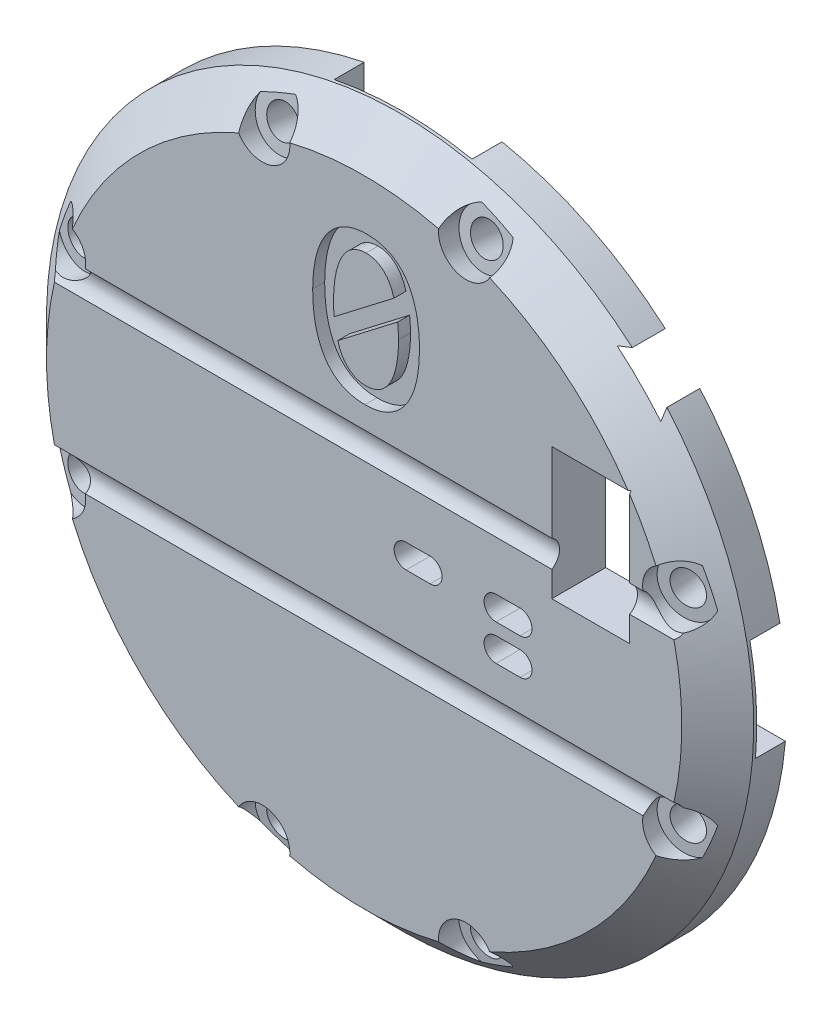
from build123d import *

# Parameters (mm, degrees)
SKETCH1_R               = 29.5
BOSS_EXTRUDE1_DEPTH     = 5.75
SKETCH3_W               = 44.5
SKETCH3_H               = 44.5
CUT_EXTRUDE1_DEPTH      = 3.25
BOSS_EXTRUDE5_DEPTH     = 3.25
CHAMFER2_SIZE           = 3
CUT_EXTRUDE5_DEPTH      = 43.113685424
CUT_EXTRUDE5_DEPTH_BACK = 43.113685424
SKETCH9_R               = 1.3
SKETCH10_W              = 12.03351403
SKETCH10_H              = 11.5
SKETCH10_W_2            = 11.5
SKETCH10_H_2            = 12.03351403
CUT_EXTRUDE6_DEPTH      = 2.5
SKETCH13_W              = 6.5
SKETCH13_H              = 11
CUT_EXTRUDE9_DEPTH      = 42.845698845
SKETCH14_W              = 15.887507813
SKETCH14_H              = 11.6
CUT_EXTRUDE10_DEPTH     = 2.5
BOSS_EXTRUDE3_START     = 2.5
BOSS_EXTRUDE3_DEPTH     = 2.5
SKETCH17_R              = 1.35
CUT_EXTRUDE12_DEPTH     = 43.113685578
CUT_EXTRUDE13_START     = 20
SKETCH18_R              = 2.3
CUT_EXTRUDE13_DEPTH     = 12.5
CIRPATTERN1_COUNT       = 4
CUT_EXTRUDE14_DEPTH     = 43.113685564
BOSS_EXTRUDE2_DEPTH     = 2
FILLET1_R               = 1
CUT_EXTRUDE16_DEPTH     = 1
BOSS_EXTRUDE4_DEPTH     = 2
CHAMFER3_SIZE           = 0.5


with BuildPart() as part:
    # Sketch1 → Boss-Extrude1 (new body)
    with BuildSketch(Plane.XY):
        Circle(SKETCH1_R)
    extrude(amount=BOSS_EXTRUDE1_DEPTH)

    # Sketch3 → Cut-Extrude1 (cut)
    with BuildSketch(Plane(origin=(0, 0, 0), x_dir=(-1, 0, 0), z_dir=(0, 0, -1))):
        Rectangle(SKETCH3_W, SKETCH3_H)
    extrude(amount=-CUT_EXTRUDE1_DEPTH, mode=Mode.SUBTRACT)

    # Sketch26 → Boss-Extrude5 (add)
    with BuildSketch(Plane(origin=(0, 0, 0), x_dir=(-1, 0, 0), z_dir=(0, 0, -1))):
        with BuildLine():
            Line((22.25, 19.369757355), (22.25, 17.809758561))
            ThreePointArc((22.25, 17.809758561), (20.152543264, 20.152543264), (17.809758561, 22.25))
            Line((17.809758561, 22.25), (19.369757355, 22.25))
            ThreePointArc((19.369757355, 22.25), (20.859650045, 20.859650045), (22.25, 19.369757355))
        make_face()
        with BuildLine():
            Line((19.369757355, -22.25), (17.809758561, -22.25))
            ThreePointArc((17.809758561, -22.25), (20.152543264, -20.152543264), (22.25, -17.809758561))
            Line((22.25, -17.809758561), (22.25, -19.369757355))
            ThreePointArc((22.25, -19.369757355), (20.859650045, -20.859650045), (19.369757355, -22.25))
        make_face()
        with BuildLine():
            Line((-22.25, -19.369757355), (-22.25, -17.809758561))
            ThreePointArc((-22.25, -17.809758561), (-20.152543264, -20.152543264), (-17.809758561, -22.25))
            Line((-17.809758561, -22.25), (-19.369757355, -22.25))
            ThreePointArc((-19.369757355, -22.25), (-20.859650045, -20.859650045), (-22.25, -19.369757355))
        make_face()
    extrude(amount=-BOSS_EXTRUDE5_DEPTH)

    # Chamfer2
    # the kernel refuses this chamfer: 3 mm, written as the material it takes off along each edge
    with BuildSketch(Plane(origin=(0, 0, 5.75), x_dir=(1, 0, 0), z_dir=(0, -1, 0))) as chamfer2_piece_1:
        Polygon((29.5, -CHAMFER2_SIZE), (29.5 - CHAMFER2_SIZE, 0), (29.5, 0), align=None)
    revolve(axis=Axis((0, 0, 5.75), (0, 0, 1)), mode=Mode.SUBTRACT)

    # Sketch9 → Cut-Extrude5 (cut, two sides: drawn at the far end of the back side and taken through both)
    with BuildSketch(Plane(origin=(0, 0, 0), x_dir=(0, 0, -1), z_dir=(1, 0, 0)).offset(-CUT_EXTRUDE5_DEPTH_BACK)):
        with Locations((-6.4, 7)):
            Circle(SKETCH9_R)
        with Locations((-6.4, -7)):
            Circle(SKETCH9_R)
    extrude(amount=CUT_EXTRUDE5_DEPTH + CUT_EXTRUDE5_DEPTH_BACK, mode=Mode.SUBTRACT)

    # Sketch10 → Cut-Extrude6 (cut)
    with BuildSketch(Plane(origin=(0, 0, 0), x_dir=(-1, 0, 0), z_dir=(0, 0, -1))):
        with Locations((28.01742408, 0)):
            Rectangle(SKETCH10_W, SKETCH10_H)
        with Locations((-28.01742408, 0)):
            Rectangle(SKETCH10_W, SKETCH10_H)
        with Locations((0, 28.01742408)):
            Rectangle(SKETCH10_W_2, SKETCH10_H_2)
    extrude(amount=-CUT_EXTRUDE6_DEPTH, mode=Mode.SUBTRACT)

    # Sketch13 → Cut-Extrude9 (cut, through all)
    with BuildSketch(Plane(origin=(0, 0, 3.25), x_dir=(-1, 0, 0), z_dir=(0, 0, -1))):
        with Locations((-18.9, 9.25)):
            Rectangle(SKETCH13_W, SKETCH13_H)
    extrude(amount=-CUT_EXTRUDE9_DEPTH, mode=Mode.SUBTRACT)

    # Sketch14 → Cut-Extrude10 (cut)
    with BuildSketch(Plane(origin=(0, 0, 0), x_dir=(-1, 0, 0), z_dir=(0, 0, -1))):
        with Locations((-27.176000206, -5.8)):
            Rectangle(SKETCH14_W, SKETCH14_H)
    extrude(amount=-CUT_EXTRUDE10_DEPTH, mode=Mode.SUBTRACT)

    # Sketch23 → Boss-Extrude3 (add)
    with BuildSketch(Plane(origin=(0, 0, 2.5), x_dir=(-1, 0, 0), z_dir=(0, 0, -1)).offset(BOSS_EXTRUDE3_START)):
        with BuildLine():
            Line((-22.25, -2.55), (-29.389581487, -2.55))
            ThreePointArc((-29.389581487, -2.55), (-28.616616042, -7.165143842), (-27.123605955, -11.6))
            Line((-27.123605955, -11.6), (-22.25, -11.6))
            Line((-22.25, -11.6), (-22.25, -2.55))
        make_face()
    extrude(amount=-BOSS_EXTRUDE3_DEPTH)

    # Sketch17 → Cut-Extrude12 (cut, through all)
    with BuildSketch(Plane(origin=(0, 0, 0), x_dir=(0, -1, 0), z_dir=(0.13917310096006574, 0, 0.9902680687415703))):
        with Locations(Location((-8.5, 24.5, 0), (0, 0, 270))):
            Circle(SKETCH17_R)
        with Locations(Location((8.5, 24.5, 0), (0, 0, 270))):
            Circle(SKETCH17_R)
    cut_extrude12 = extrude(amount=CUT_EXTRUDE12_DEPTH, mode=Mode.SUBTRACT)

    # Sketch18 → Cut-Extrude13 (cut)
    with BuildSketch(Plane(origin=(0, 0, 0), x_dir=(0, -1, 0), z_dir=(0.13917310096006574, 0, 0.9902680687415703)).offset(CUT_EXTRUDE13_START)):
        with Locations((-8.5, 24.5)):
            Circle(SKETCH18_R)
        with Locations((8.5, 24.5)):
            Circle(SKETCH18_R)
    cut_extrude13 = extrude(amount=-CUT_EXTRUDE13_DEPTH, mode=Mode.SUBTRACT)

    # CirPattern1: Cut-Extrude12, Cut-Extrude13 ×4 about axis
    cirpattern1_axis = Axis((0, 0, 0), (0, 0, 1))
    add([cut_extrude12.rotate(cirpattern1_axis, i * 360 / CIRPATTERN1_COUNT) for i in range(1, CIRPATTERN1_COUNT)], mode=Mode.SUBTRACT)
    add([cut_extrude13.rotate(cirpattern1_axis, i * 360 / CIRPATTERN1_COUNT) for i in range(1, CIRPATTERN1_COUNT)], mode=Mode.SUBTRACT)

    # Sketch19 → Cut-Extrude14 (cut, through all)
    with BuildSketch(Plane.XY.offset(5.75)):
        with BuildLine():
            Line((3.5, 1.75), (5.5, 1.75))
            ThreePointArc((5.5, 1.75), (6.5, 0.75), (5.5, -0.25))
            Line((5.5, -0.25), (3.5, -0.25))
            ThreePointArc((3.5, -0.25), (2.5, 0.75), (3.5, 1.75))
        make_face()
        with BuildLine():
            Line((11, 1.75), (13, 1.75))
            ThreePointArc((13, 1.75), (14, 0.75), (13, -0.25))
            Line((13, -0.25), (11, -0.25))
            ThreePointArc((11, -0.25), (10, 0.75), (11, 1.75))
        make_face()
        with BuildLine():
            Line((11, -1.25), (13, -1.25))
            ThreePointArc((13, -1.25), (14, -2.25), (13, -3.25))
            Line((13, -3.25), (11, -3.25))
            ThreePointArc((11, -3.25), (10, -2.25), (11, -1.25))
        make_face()
    extrude(amount=-CUT_EXTRUDE14_DEPTH, mode=Mode.SUBTRACT)

    # Sketch21 → Boss-Extrude2 (add)
    # profile 1 of 2: a face of its own
    with BuildSketch(Plane(origin=(0, 0, 3.25), x_dir=(-1, 0, 0), z_dir=(0, 0, -1))):
        with BuildLine():
            Line((-5.5, -1.35), (-3.5, -1.35))
            ThreePointArc((-3.5, -1.35), (-1.4, 0.75), (-3.5, 2.85))
            Line((-3.5, 2.85), (-5.5, 2.85))
            ThreePointArc((-5.5, 2.85), (-7.6, 0.75), (-5.5, -1.35))
        make_face()
        with BuildLine():
            Line((-5.5, -0.35), (-3.5, -0.35))
            ThreePointArc((-3.5, -0.35), (-2.4, 0.75), (-3.5, 1.85))
            Line((-3.5, 1.85), (-5.5, 1.85))
            ThreePointArc((-5.5, 1.85), (-6.6, 0.75), (-5.5, -0.35))
        make_face(mode=Mode.SUBTRACT)
    # profile 2 of 2: a face of its own
    with BuildSketch(Plane(origin=(0, 0, 3.25), x_dir=(-1, 0, 0), z_dir=(0, 0, -1))):
        with BuildLine():
            Line((-11, 2.85), (-13, 2.85))
            ThreePointArc((-13, 2.85), (-14.94422221, 1.543725393), (-14.469693846, -0.75))
            ThreePointArc((-14.469693846, -0.75), (-14.94422221, -3.043725393), (-13, -4.35))
            Line((-13, -4.35), (-11, -4.35))
            ThreePointArc((-11, -4.35), (-9.05577779, -3.043725393), (-9.530306154, -0.75))
            ThreePointArc((-9.530306154, -0.75), (-9.05577779, 1.543725393), (-11, 2.85))
        make_face()
        with BuildLine():
            Line((-11, 1.85), (-13, 1.85))
            ThreePointArc((-13, 1.85), (-14.1, 0.75), (-13, -0.35))
            Line((-13, -0.35), (-11, -0.35))
            ThreePointArc((-11, -0.35), (-9.9, 0.75), (-11, 1.85))
        make_face(mode=Mode.SUBTRACT)
        with BuildLine():
            Line((-11, -1.15), (-13, -1.15))
            ThreePointArc((-13, -1.15), (-14.1, -2.25), (-13, -3.35))
            Line((-13, -3.35), (-11, -3.35))
            ThreePointArc((-11, -3.35), (-9.9, -2.25), (-11, -1.15))
        make_face(mode=Mode.SUBTRACT)
    extrude(amount=BOSS_EXTRUDE2_DEPTH)

    # Fillet1
    fillet1_edges = [part.edges().sort_by_distance(p)[0] for p in [
        (7.6, 0.75, 3.25),
        (4.5, -1.35, 3.25),
        (1.4, 0.75, 3.25),
        (4.5, 2.85, 3.25),
        (14.94422221, -3.043725393, 3.25),
        (12, -4.35, 3.25),
        (9.05577779, -3.043725393, 3.25),
    ]]
    fillet(fillet1_edges, radius=FILLET1_R)

    # Sketch24 → Cut-Extrude16 (cut)
    with BuildSketch(Plane.XY.offset(5.75)):
        with BuildLine():
            add(Edge.make_bspline(
                [(4.61211941, 16.170450521), (4.609629847, 15.944710661), (4.604753386, 15.502540156), (4.5474431, 14.855747051), (4.461834353, 14.238402943), (4.339569969, 13.652833419), (4.184435004, 13.101054198), (3.985267501, 12.58976335), (3.755527346, 12.116733529), (3.48713078, 11.685448982), (3.183653033, 11.298830964), (2.844863255, 10.956051233), (2.470202852, 10.660423402), (2.059568041, 10.412999717), (1.614490849, 10.213057971), (1.129845793, 10.076559514), (0.609812084, 9.988743691), (0.25038528, 9.979838517), (0.065336217, 9.975253733)],
                knots=[0, 0, 0, 0, 1.248871528, 2.446241243, 3.590357027, 4.69618527, 5.754202854, 6.758290001, 7.728669934, 8.660396172, 9.563796911, 10.443071522, 11.321307858, 12.197637495, 13.090115231, 14.012601613, 14.976798049, 16, 16, 16, 16], degree=3))
            add(Edge.make_bspline(
                [(0.065336217, 9.975253733), (-0.095009986, 9.979157064), (-0.410839977, 9.986845358), (-0.873176697, 10.056194869), (-1.312758847, 10.171936701), (-1.730384642, 10.328642103), (-2.12104236, 10.538148865), (-2.482674643, 10.796422121), (-2.816831896, 11.102205137), (-3.117803226, 11.460864468), (-3.388575826, 11.86875509), (-3.623464032, 12.33033077), (-3.826539278, 12.841315562), (-3.999911714, 13.403819828), (-4.130762705, 14.020606741), (-4.229063227, 14.689502725), (-4.285631541, 15.41258653), (-4.292374342, 15.911990637), (-4.295863988, 16.170450521)],
                knots=[0, 0, 0, 0, 0.897102697, 1.767001224, 2.609309556, 3.43771295, 4.257811968, 5.082953918, 5.919052252, 6.786174452, 7.6970727, 8.653553743, 9.679470751, 10.771494031, 11.944028827, 13.204944144, 14.553456404, 16, 16, 16, 16], degree=3))
            add(Edge.make_bspline(
                [(-4.295863988, 16.170450521), (-4.291796106, 16.396146108), (-4.283813508, 16.83903925), (-4.233047824, 17.488264024), (-4.14258563, 18.107103849), (-4.018386797, 18.693789118), (-3.858208569, 19.246227744), (-3.662549083, 19.759570194), (-3.433020668, 20.23275539), (-3.167598633, 20.66461996), (-2.865470038, 21.052747666), (-2.525748193, 21.395613482), (-2.150834305, 21.6922239), (-1.737706369, 21.938770374), (-1.290753387, 22.138279627), (-0.806278818, 22.274977128), (-0.289021583, 22.362965532), (0.067688601, 22.371949287), (0.250919205, 22.376563954)],
                knots=[0, 0, 0, 0, 1.248165713, 2.449334701, 3.598380242, 4.704508407, 5.763215836, 6.776019403, 7.739017366, 8.667464557, 9.574217704, 10.452902578, 11.330549874, 12.210601904, 13.107080692, 14.028948355, 14.987533857, 16, 16, 16, 16], degree=3))
            add(Edge.make_bspline(
                [(0.250919205, 22.376563954), (0.411269181, 22.372660629), (0.727106604, 22.364972345), (1.188517072, 22.295753627), (1.627789233, 22.18029158), (2.043744989, 22.018946136), (2.436535735, 21.812746675), (2.797205806, 21.551596472), (3.130472077, 21.244113249), (3.430647106, 20.883070242), (3.702412373, 20.47370193), (3.939457778, 20.01310548), (4.140595821, 19.50024029), (4.311854836, 18.93834067), (4.448443999, 18.322627028), (4.544926285, 17.654041974), (4.602069238, 16.930160011), (4.608688101, 16.429828958), (4.61211941, 16.170450521)],
                knots=[0, 0, 0, 0, 0.896490568, 1.765795528, 2.602608418, 3.432274242, 4.256303472, 5.076742829, 5.915718828, 6.786140009, 7.696416714, 8.659101079, 9.677705081, 10.773848187, 11.941709476, 13.20176442, 14.549356535, 16, 16, 16, 16], degree=3))
        make_face()
        with BuildLine():
            add(Edge.make_bspline(
                [(2.865455999, 16.077659027), (2.864839005, 16.182323934), (2.863609324, 16.390923317), (2.840362021, 16.701771488), (2.82092987, 17.008594617), (2.801406756, 17.211212302), (2.791768636, 17.311240061)],
                knots=[0, 0, 0, 0, 1.015676625, 2.024265076, 3.024624451, 4, 4, 4, 4], degree=3))
            Line((2.791768636, 17.311240061), (-2.208055379, 13.468580556))
            add(Edge.make_bspline(
                [(-2.208055379, 13.468580556), (-2.15883924, 13.321137051), (-2.062306301, 13.031940146), (-1.876021988, 12.624239729), (-1.647689417, 12.260106137), (-1.373202208, 11.950099151), (-1.054058419, 11.70114286), (-0.756867451, 11.542285481), (-0.497626757, 11.456417233), (-0.289850061, 11.405797387), (-0.068113772, 11.380151789), (0.083478776, 11.375141757), (0.160856873, 11.372584462)],
                knots=[0, 0, 0, 0, 1.361870802, 2.671184605, 3.91877896, 5.116024374, 6.280451232, 7.450298556, 8.047911377, 8.670688444, 9.321473259, 10, 10, 10, 10], degree=3))
            add(Edge.make_bspline(
                [(0.160856873, 11.372584462), (0.261236207, 11.37605025), (0.459132471, 11.382882995), (0.747845416, 11.443326699), (1.023392987, 11.534783817), (1.282500154, 11.668912059), (1.526984601, 11.837213529), (1.747490888, 12.049106291), (1.955116864, 12.290390253), (2.139647736, 12.571150526), (2.305971243, 12.886730108), (2.453949566, 13.237943691), (2.577781922, 13.625580337), (2.680802736, 14.048969947), (2.765584334, 14.506147776), (2.824395418, 14.999278733), (2.860316703, 15.526735082), (2.863707249, 15.890195913), (2.865455999, 16.077659027)],
                knots=[0, 0, 0, 0, 0.796240393, 1.569775284, 2.332781704, 3.095240773, 3.878796528, 4.681173991, 5.516437293, 6.40201063, 7.34239963, 8.345981007, 9.424260963, 10.57011489, 11.804224653, 13.114209461, 14.5115885, 16, 16, 16, 16], degree=3))
        make_face(mode=Mode.SUBTRACT)
        with BuildLine():
            add(Edge.make_bspline(
                [(-2.549200577, 16.189554652), (-2.549314077, 16.092214042), (-2.549541082, 15.897528572), (-2.547848715, 15.607261836), (-2.538220317, 15.321297037), (-2.521814903, 15.133315979), (-2.513721476, 15.040577626)],
                knots=[0, 0, 0, 0, 1.015676347, 2.03139705, 3.028811753, 4, 4, 4, 4], degree=3))
            Line((-2.513721476, 15.040577626), (2.488831701, 18.883237131))
            add(Edge.make_bspline(
                [(2.488831701, 18.883237131), (2.441519721, 19.032928382), (2.34951335, 19.324029042), (2.154657958, 19.726475414), (1.932110388, 20.089680276), (1.657641813, 20.394726329), (1.347016239, 20.649855815), (1.050175177, 20.804573168), (0.796234371, 20.895771925), (0.592448081, 20.945854153), (0.377120221, 20.971599281), (0.230053591, 20.976662829), (0.15539855, 20.979233225)],
                knots=[0, 0, 0, 0, 1.387569518, 2.698370158, 3.946895934, 5.144331536, 6.312393877, 7.486406228, 8.084826247, 8.697958228, 9.339048001, 10, 10, 10, 10], degree=3))
            add(Edge.make_bspline(
                [(0.15539855, 20.979233225), (0.055054687, 20.975663768), (-0.142771643, 20.968626641), (-0.431442528, 20.909788248), (-0.705746907, 20.812659892), (-0.965915663, 20.678305819), (-1.210843072, 20.5062074), (-1.431927482, 20.290626753), (-1.642642062, 20.045358222), (-1.825741263, 19.755612591), (-1.992375785, 19.433461386), (-2.137705442, 19.074210804), (-2.260647813, 18.679364009), (-2.368655055, 18.249806697), (-2.448304665, 17.784320395), (-2.508444977, 17.284351538), (-2.543962845, 16.748640248), (-2.547418846, 16.379740037), (-2.549200577, 16.189554652)],
                knots=[0, 0, 0, 0, 0.786453526, 1.550480632, 2.299704824, 3.062398082, 3.840423392, 4.637837687, 5.478332318, 6.370910143, 7.318703432, 8.320397478, 9.40580758, 10.560070273, 11.791787257, 13.106920475, 14.508481623, 16, 16, 16, 16], degree=3))
        make_face(mode=Mode.SUBTRACT)
    extrude(amount=-CUT_EXTRUDE16_DEPTH, mode=Mode.SUBTRACT)

    # Sketch25 → Boss-Extrude4 (add)
    with BuildSketch(Plane(origin=(0, 0, 3.25), x_dir=(-1, 0, 0), z_dir=(0, 0, -1))):
        Polygon((-22.25, 15.75), (-22.25, 14.75), (-15.65, 14.75), (-15.65, 3.75), (-22.25, 3.75), (-22.25, 2.75), (-14.65, 2.75), (-14.65, 15.75), align=None)
    extrude(amount=BOSS_EXTRUDE4_DEPTH)

    # Chamfer3
    chamfer3_edges = [part.edges().sort_by_distance(p)[0] for p in [
        (18.45, 15.75, 1.25),
        (18.45, 2.75, 1.25),
        (14.65, 9.25, 1.25),
    ]]
    chamfer(chamfer3_edges, length=CHAMFER3_SIZE)


solid = part.part
